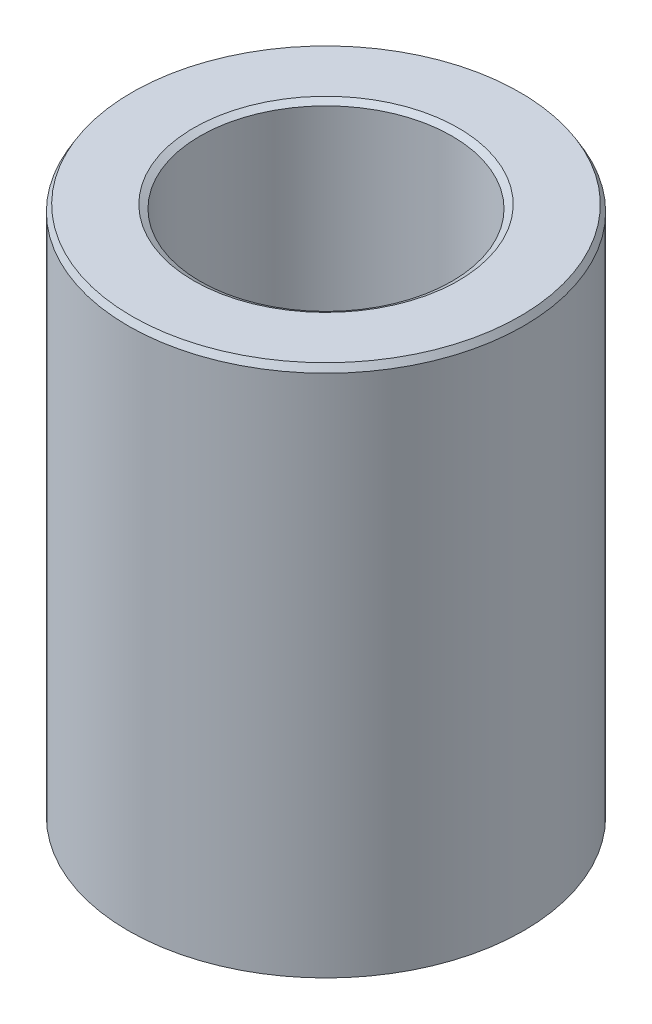
from build123d import *
from OCP.BRepFilletAPI import BRepFilletAPI_MakeChamfer

# Parameters (mm, degrees)
SKETCH1_R           = 57.5
BOSS_EXTRUDE1_DEPTH = 155.263865833
SKETCH2_R           = 36.612677988
CUT_EXTRUDE1_DEPTH  = 176.269415568
CHAMFER1_SIZE       = 1.881439243
CHAMFER1_SIZE2      = 1.086249454


with BuildPart() as part:
    # Sketch1 → Boss-Extrude1 (new body)
    with BuildSketch(Plane(origin=(0, 0, 0), x_dir=(1, 0, 0), z_dir=(0, 1, 0))):
        Circle(SKETCH1_R)
    extrude(amount=BOSS_EXTRUDE1_DEPTH)

    # Sketch2 → Cut-Extrude1 (cut, through all)
    with BuildSketch(Plane(origin=(0, 0, 0), x_dir=(1, 0, 0), z_dir=(0, 1, 0))):
        Circle(SKETCH2_R)
    extrude(amount=CUT_EXTRUDE1_DEPTH, mode=Mode.SUBTRACT)

    # Chamfer1: one chamfer whose edges measure the first distance from different faces: ONE call of the kernel's chamfer builder (chamfer() names one face for all edges)
    chamfer1_edges_1 = [part.edges().sort_by_distance(p)[0] for p in [
        (-36.612677988, 155.263865833, 0),
    ]]
    chamfer1_side_1 = [part.faces().sort_by_distance(p)[0] for p in [
        (-55.873654403, 155.263865833, 0),
    ]]
    chamfer1_edges_2 = [part.edges().sort_by_distance(p)[0] for p in [
        (-36.612677988, 0, 0),
    ]]
    chamfer1_side_2 = [part.faces().sort_by_distance(p)[0] for p in [
        (-36.612677988, 77.631932917, 0),
    ]]
    chamfer1_edges_3 = [part.edges().sort_by_distance(p)[0] for p in [
        (-57.5, 0, 0),
    ]]
    chamfer1_side_3 = [part.faces().sort_by_distance(p)[0] for p in [
        (-55.873654403, 0, 0),
    ]]
    chamfer1_edges_4 = [part.edges().sort_by_distance(p)[0] for p in [
        (-57.5, 155.263865833, 0),
    ]]
    chamfer1_side_4 = [part.faces().sort_by_distance(p)[0] for p in [
        (-57.5, 77.631932917, 0),
    ]]
    chamfer1 = BRepFilletAPI_MakeChamfer(part.part.solid().wrapped)
    for e in chamfer1_edges_1:
        chamfer1.Add(CHAMFER1_SIZE, CHAMFER1_SIZE2, e.wrapped, chamfer1_side_1[0].wrapped)  # the first distance lies on this face
    for e in chamfer1_edges_2:
        chamfer1.Add(CHAMFER1_SIZE, CHAMFER1_SIZE2, e.wrapped, chamfer1_side_2[0].wrapped)  # the first distance lies on this face
    for e in chamfer1_edges_3:
        chamfer1.Add(CHAMFER1_SIZE, CHAMFER1_SIZE2, e.wrapped, chamfer1_side_3[0].wrapped)  # the first distance lies on this face
    for e in chamfer1_edges_4:
        chamfer1.Add(CHAMFER1_SIZE, CHAMFER1_SIZE2, e.wrapped, chamfer1_side_4[0].wrapped)  # the first distance lies on this face
    add(Compound.cast(chamfer1.Shape()), mode=Mode.REPLACE)


solid = part.part
